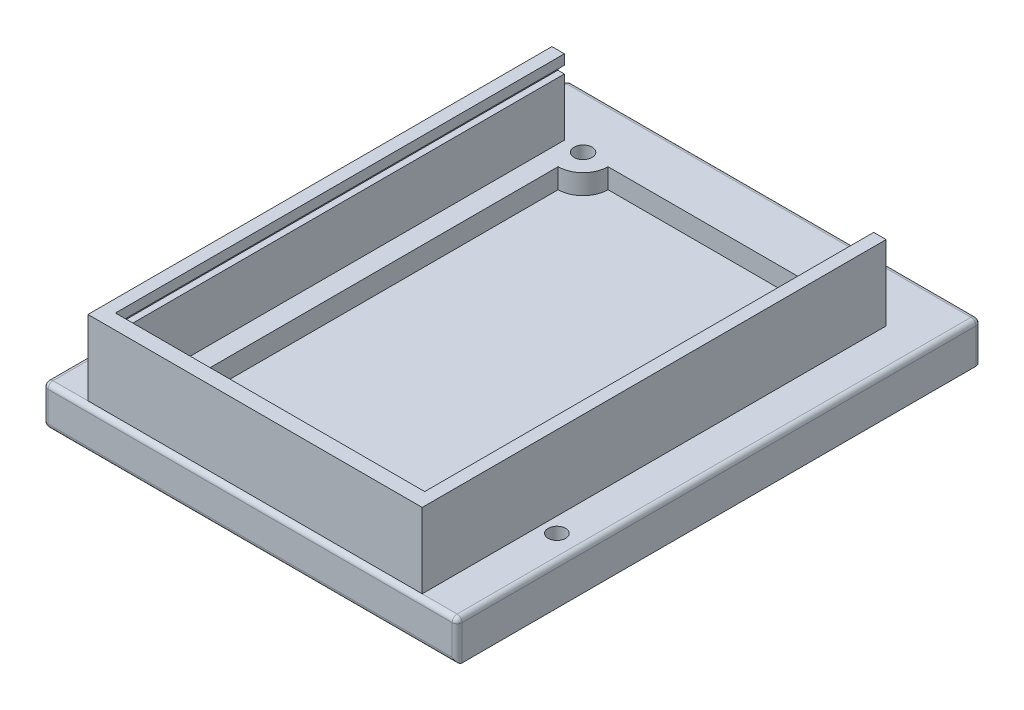
from build123d import *

# Parameters (mm, degrees)
SKETCH1_W                      = 83
SKETCH1_H                      = 105
SKETCH1_R                      = 1.75
BOSS_EXTRUDE1_DEPTH            = 8
CBORE_FOR_M3_SHCS1_OUTLINE_R   = 3.25
CBORE_FOR_M3_SHCS1_DEPTH       = 3
CBORE_START                    = 3
CBORE_FOR_M3_SHCS1_2_OUTLINE_R = 1.8
CBORE_FOR_M3_SHCS1_2_DEPTH     = 5
CUT_EXTRUDE1_DEPTH             = 4
SKETCH6_W                      = 5
SKETCH6_H                      = 20
BOSS_EXTRUDE2_DEPTH            = 8.8
SKETCH7_W                      = 3.2
SKETCH7_H                      = 6.8
CUT_EXTRUDE2_DEPTH             = 103.793190436
FILLET1_SIZE                   = 6
FILLET1_SIZE_2                 = 8
FILLET2_R                      = 1
SKETCH8_W                      = 67
SKETCH8_H                      = 93
BOSS_EXTRUDE4_DEPTH            = 15
CUT_EXTRUDE3_DEPTH             = 90
SKETCH12_W                     = 64.6
SKETCH12_H                     = 1.5
CUT_EXTRUDE4_DEPTH             = 1


# Read off the part's stored shape, not the designer's step: CBORE for M3 SHCS1
with BuildPart() as part:
    # Sketch1 → Boss-Extrude1 (new body)
    with BuildSketch(Plane(origin=(0, 0, 0), x_dir=(1, 0, 0), z_dir=(0, 1, 0))):
        with Locations((41.5, 52.5)):
            Rectangle(SKETCH1_W, SKETCH1_H)
        with Locations(Location((5, 25, 0), (0, 0, 270))):
            Circle(SKETCH1_R, mode=Mode.SUBTRACT)
        with Locations(Location((78, 25, 0), (0, 0, 90))):
            Circle(SKETCH1_R, mode=Mode.SUBTRACT)
    extrude(amount=BOSS_EXTRUDE1_DEPTH)

    # CBORE for M3 SHCS1 outline → CBORE for M3 SHCS1 (cut)
    with BuildSketch(Plane(origin=(0, 0, 0), x_dir=(1, 0, 0), z_dir=(0, 1, 0))):
        with Locations((14.475, 93.775)):
            Circle(CBORE_FOR_M3_SHCS1_OUTLINE_R)
        with Locations((68.525, 93.775)):
            Circle(CBORE_FOR_M3_SHCS1_OUTLINE_R)
        with Locations((68.525, 11.225)):
            Circle(CBORE_FOR_M3_SHCS1_OUTLINE_R)
        with Locations((14.475, 11.225)):
            Circle(CBORE_FOR_M3_SHCS1_OUTLINE_R)
    extrude(amount=CBORE_FOR_M3_SHCS1_DEPTH, mode=Mode.SUBTRACT)

    # CBORE for M3 SHCS1 2 outline → CBORE for M3 SHCS1 2 (cut)
    with BuildSketch(Plane(origin=(0, 0, 0), x_dir=(1, 0, 0), z_dir=(0, 1, 0)).offset(CBORE_START)):
        with Locations((14.475, 93.775)):
            Circle(CBORE_FOR_M3_SHCS1_2_OUTLINE_R)
        with Locations((68.525, 93.775)):
            Circle(CBORE_FOR_M3_SHCS1_2_OUTLINE_R)
        with Locations((68.525, 11.225)):
            Circle(CBORE_FOR_M3_SHCS1_2_OUTLINE_R)
        with Locations((14.475, 11.225)):
            Circle(CBORE_FOR_M3_SHCS1_2_OUTLINE_R)
    extrude(amount=CBORE_FOR_M3_SHCS1_2_DEPTH, mode=Mode.SUBTRACT)

    # Sketch5 → Cut-Extrude1 (cut)
    with BuildSketch(Plane(origin=(0, 8, 0), x_dir=(1, 0, 0), z_dir=(0, 1, 0))):
        with BuildLine():
            Line((19.475, 93.775), (63.525, 93.775))
            ThreePointArc((63.525, 93.775), (64.989466094, 90.239466094), (68.525, 88.775))
            Line((68.525, 88.775), (68.525, 16.225))
            ThreePointArc((68.525, 16.225), (64.989466094, 14.760533906), (63.525, 11.225))
            Line((63.525, 11.225), (19.475, 11.225))
            ThreePointArc((19.475, 11.225), (18.010533906, 14.760533906), (14.475, 16.225))
            Line((14.475, 16.225), (14.475, 88.775))
            ThreePointArc((14.475, 88.775), (18.010533906, 90.239466094), (19.475, 93.775))
        make_face()
    extrude(amount=-CUT_EXTRUDE1_DEPTH, mode=Mode.SUBTRACT)

    # Sketch6 → Boss-Extrude2 (add)
    with BuildSketch(Plane.XZ):
        with Locations((13.975, -50)):
            Rectangle(SKETCH6_W, SKETCH6_H)
    extrude(amount=BOSS_EXTRUDE2_DEPTH)

    # Sketch7 → Cut-Extrude2 (cut, through all)
    with BuildSketch(Plane(origin=(0, 0, -60), x_dir=(-1, 0, 0), z_dir=(0, 0, -1))):
        with Locations((-13.075, -3.4)):
            Rectangle(SKETCH7_W, SKETCH7_H)
    extrude(amount=-CUT_EXTRUDE2_DEPTH, mode=Mode.SUBTRACT)

    # Fillet1
    # an asymmetric fillet: 8, 6 mm, written as the material it adds along each edge
    with BuildSketch(Plane(origin=(16.475, 0, -40), x_dir=(1, 0, 0), z_dir=(0, 0, -1))) as fillet1_piece_1:
        with BuildLine():
            Bezier((FILLET1_SIZE, 0), (0, 0), (0, FILLET1_SIZE_2), weights=[1, 0.707106781, 1])
            Line((0, FILLET1_SIZE_2), (0, 0))
            Line((0, 0), (FILLET1_SIZE, 0))
        make_face()
    extrude(amount=20)

    # Fillet2
    fillet2_edges = [part.edges().sort_by_distance(p)[0] for p in [
        (83, 8, -52.5),
        (41.5, 8, -105),
        (0, 8, -52.5),
        (41.5, 0, 0),
        (0, 0, -52.5),
        (0, 4, -105),
        (83, 4, -105),
        (83, 4, 0),
        (0, 4, 0),
        (41.5, 8, 0),
    ]]
    fillet(fillet2_edges, radius=FILLET2_R)

    # Sketch8 → Boss-Extrude4 (add)
    with BuildSketch(Plane(origin=(0, 8, 0), x_dir=(1, 0, 0), z_dir=(0, 1, 0))):
        with Locations((41.5, 47.5)):
            Rectangle(SKETCH8_W, SKETCH8_H)
    extrude(amount=BOSS_EXTRUDE4_DEPTH)

    # Sketch11 → Cut-Extrude3 (cut)
    with BuildSketch(Plane(origin=(0, 0, -94), x_dir=(-1, 0, 0), z_dir=(0, 0, -1))):
        Polygon((-72.5, 8), (-10.5, 8), (-10.5, 19.5), (-9.2, 19.5), (-9.2, 21), (-10.5, 21), (-10.5, 23), (-72.5, 23), (-72.5, 21), (-73.8, 21), (-73.8, 19.5), (-72.5, 19.5), align=None)
    extrude(amount=-CUT_EXTRUDE3_DEPTH, mode=Mode.SUBTRACT)

    # Sketch12 → Cut-Extrude4 (cut)
    with BuildSketch(Plane(origin=(0, 0, -4), x_dir=(-1, 0, 0), z_dir=(0, 0, -1))):
        with Locations((-41.5, 20.25)):
            Rectangle(SKETCH12_W, SKETCH12_H)
    extrude(amount=-CUT_EXTRUDE4_DEPTH, mode=Mode.SUBTRACT)


solid = part.part
